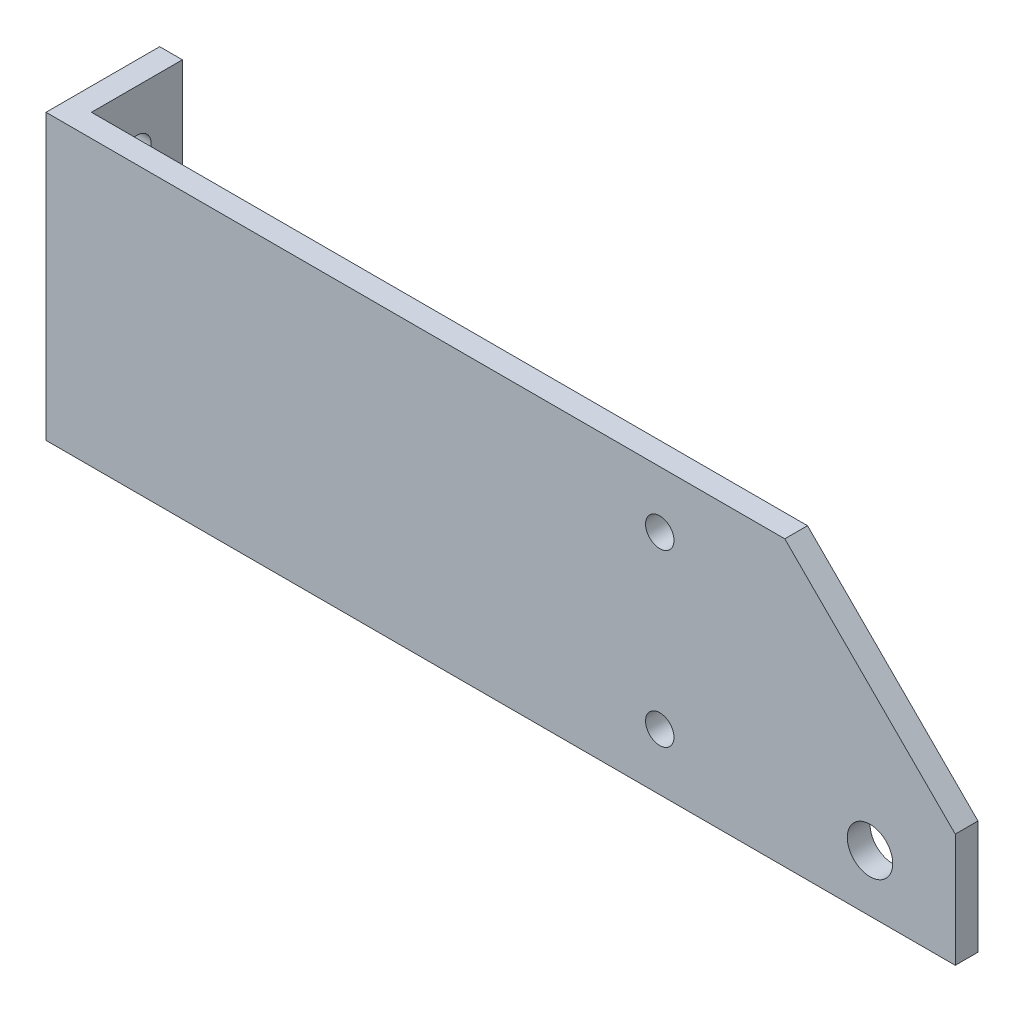
from build123d import *

# Parameters (mm, degrees)
EXTRUDE_1_DEPTH     = 50
SKETCH_2_R          = 2.5
CUT_EXTRUDE_1_DEPTH = 10
SKETCH_3_R          = 2.5
SKETCH_3_R_2        = 4
CUT_EXTRUDE_2_DEPTH = 10
CUT_EXTRUDE_3_DEPTH = 10


with BuildPart() as part:
    # Эскиз1 → Бобышка-Вытянуть1 (new body)
    with BuildSketch(Plane(origin=(0, 0, 0), x_dir=(1, 0, 0), z_dir=(0, 1, 0))):
        Polygon((0, 0), (160, 0), (160, 4), (4, 4), (4, 20), (0, 20), (0, 4), align=None)
    extrude(amount=EXTRUDE_1_DEPTH)

    # Эскиз2 → Вырез-Вытянуть1 (cut)
    with BuildSketch(Plane.ZY):
        with Locations((-12, 40)):
            Circle(SKETCH_2_R)
        with Locations((-12, 10)):
            Circle(SKETCH_2_R)
    extrude(amount=-CUT_EXTRUDE_1_DEPTH, mode=Mode.SUBTRACT)

    # Эскиз3 → Вырез-Вытянуть2 (cut)
    with BuildSketch(Plane.XY):
        with Locations((108, 40)):
            Circle(SKETCH_3_R)
        with Locations((108, 10)):
            Circle(SKETCH_3_R)
        with Locations((145, 10)):
            Circle(SKETCH_3_R_2)
    extrude(amount=-CUT_EXTRUDE_2_DEPTH, mode=Mode.SUBTRACT)

    # Эскиз4 → Вырез-Вытянуть3 (cut)
    with BuildSketch(Plane.XY):
        Polygon((160, 20), (130, 50), (160, 50), align=None)
    extrude(amount=-CUT_EXTRUDE_3_DEPTH, mode=Mode.SUBTRACT)


solid = part.part
